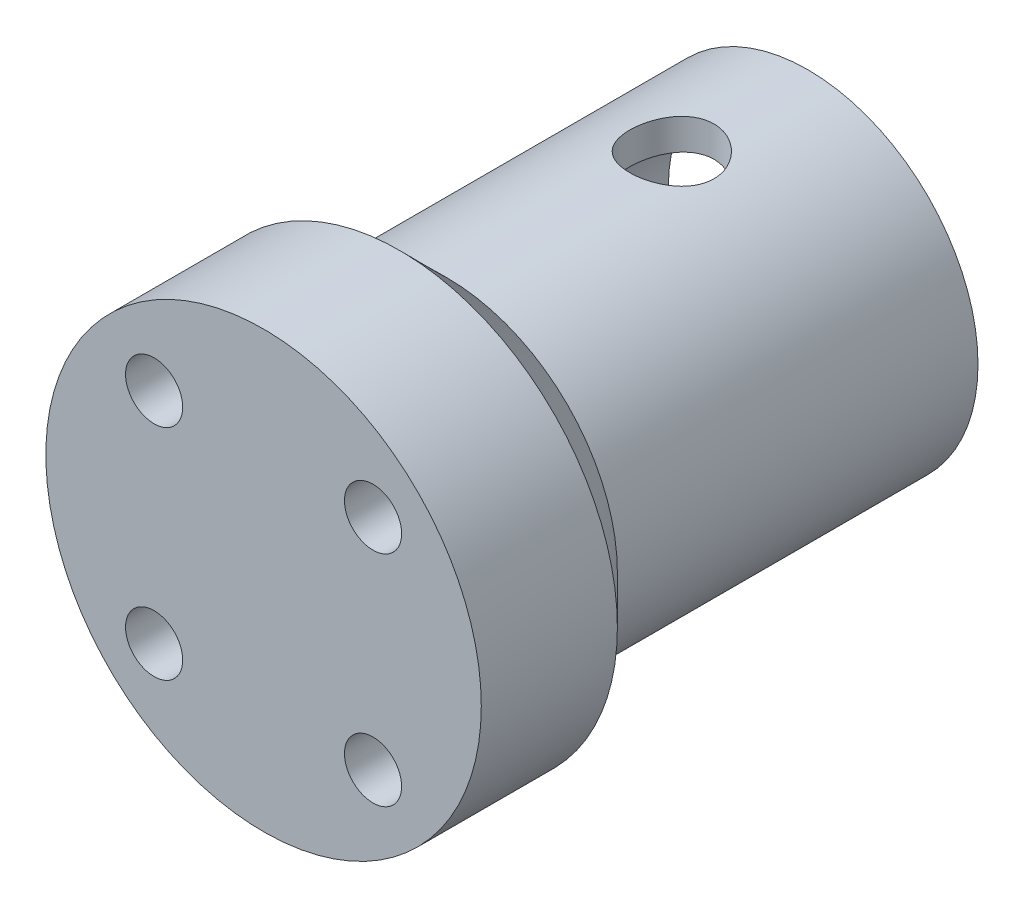
from build123d import *

# Parameters (mm, degrees)
SKETCH_1_R          = 16
EXTRUDE_1_DEPTH     = 10
SKETCH_2_R          = 12.5
SKETCH_2_R_2        = 10.25
EXTRUDE_2_DEPTH     = 30
SKETCH_3_R          = 2.1
CUT_EXTRUDE_1_DEPTH = 8
SKETCH_5_R          = 3.1
CUT_EXTRUDE_2_DEPTH = 15
CHAMFER_1_SIZE      = 3.5


with BuildPart() as part:
    # 草图1 → 凸台-拉伸1 (new body)
    with BuildSketch(Plane.XY):
        Circle(SKETCH_1_R)
    extrude(amount=EXTRUDE_1_DEPTH)

    # 草图2 → 凸台-拉伸2 (add)
    with BuildSketch(Plane(origin=(0, 0, 0), x_dir=(-1, 0, 0), z_dir=(0, 0, -1))):
        with Locations(Location((0, 0, 0), (0, 0, 180))):
            Circle(SKETCH_2_R)
        Circle(SKETCH_2_R_2, mode=Mode.SUBTRACT)
    extrude(amount=EXTRUDE_2_DEPTH)

    # 草图3 → 切除-拉伸1 (cut)
    with BuildSketch(Plane.XY.offset(10)):
        with Locations((-8.044168072, 8.044168072)):
            Circle(SKETCH_3_R)
        with Locations((8.044168072, 8.044168072)):
            Circle(SKETCH_3_R)
        with Locations((8.044168072, -8.044168072)):
            Circle(SKETCH_3_R)
        with Locations((-8.044168072, -8.044168072)):
            Circle(SKETCH_3_R)
    extrude(amount=-CUT_EXTRUDE_1_DEPTH, mode=Mode.SUBTRACT)

    # 草图5 → 切除-拉伸2 (cut, symmetric)
    with BuildSketch(Plane(origin=(0, 0, 0), x_dir=(1, 0, 0), z_dir=(0, 1, 0))):
        with Locations(Location((0, 20, 0), (0, 0, 270))):
            Circle(SKETCH_5_R)
    extrude(amount=CUT_EXTRUDE_2_DEPTH, both=True, mode=Mode.SUBTRACT)

    # 倒角1
    chamfer_1_edges = [part.edges().sort_by_distance(p)[0] for p in [
        (-12.5, 0, 0),
    ]]
    chamfer(chamfer_1_edges, length=CHAMFER_1_SIZE - 0.0001)  # a hair under: the kernel refuses the full size


solid = part.part
